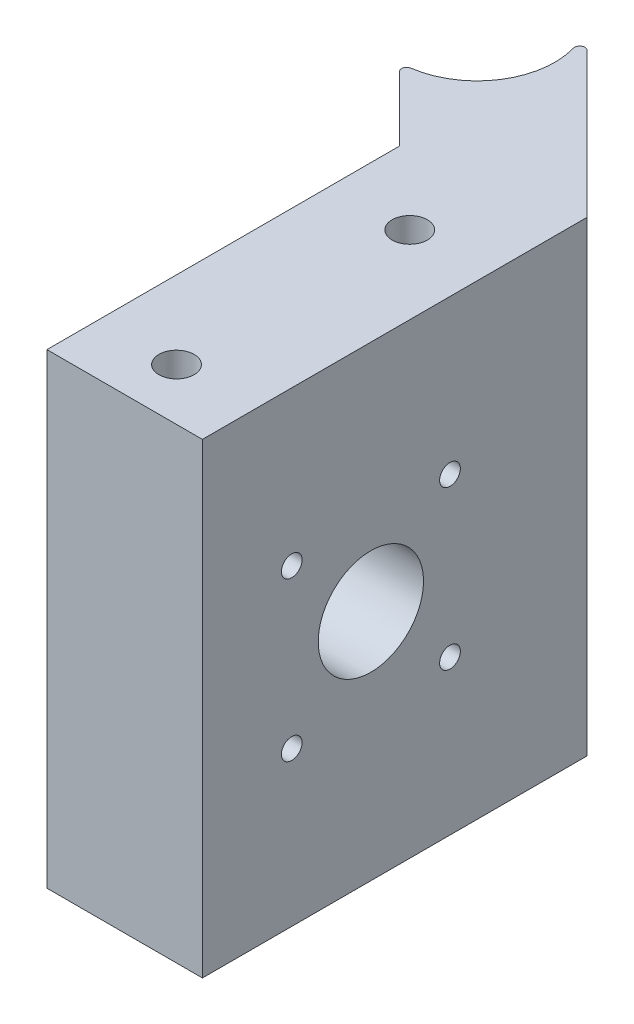
from build123d import *

# Parameters (mm, degrees)
SKETCH1_R           = 1.7
BOSS_EXTRUDE1_DEPTH = 45
CUT_EXTRUDE1_REACH  = 71.934
SKETCH2_R           = 5.0800000000000045
SKETCH2_R_2         = 1.0000000000000009
SKETCH2_R_3         = 1.0000000000000018
FILLET1_R           = 0.5
CUT_EXTRUDE2_DEPTH  = 2
CUT_EXTRUDE3_START  = 17
CUT_EXTRUDE3_DEPTH  = 2


with BuildPart() as part:
    # Sketch1 → Boss-Extrude1 (new body)
    with BuildSketch(Plane(origin=(0, 0, 0), x_dir=(1, 0, 0), z_dir=(0, 1, 0))):
        with BuildLine():
            Line((-7.499999999999999, -5.000000000000001), (7.500000000000001, -4.999999999999999))
            Line((7.500000000000001, -5), (7.499999999999998, 32.10660171779804))
            Line((7.499999999999998, 32.10660171779804), (-9.196699141100867, 48.80330085889908))
            ThreePointArc((-9.196699141100867, 48.80330085889908), (-7.57090350616536, 40.62987425726181), (-14.499999999999998, 36))
            Line((-14.499999999999998, 36), (-7.5, 28.999999999999925))
            Line((-7.5, 28.99999999999993), (-7.499999999999999, -5.000000000000001))
        make_face()
        Circle(SKETCH1_R, mode=Mode.SUBTRACT)
        with Locations((0, 22.5)):
            Circle(SKETCH1_R, mode=Mode.SUBTRACT)
    extrude(amount=BOSS_EXTRUDE1_DEPTH)

    # Sketch2 → Cut-Extrude1 (cut, up to next)
    with BuildSketch(Plane(origin=(7.500000000000001, 0, -5.3e-16), x_dir=(-1.2e-16, 0, -1), z_dir=(1, 0, -1.2e-16)), mode=Mode.PRIVATE) as cut_extrude1_sk1:
        with Locations((11.25, 22.5)):
            Circle(SKETCH2_R)
    cut_extrude1_tool1 = extrude(cut_extrude1_sk1.sketch, amount=-CUT_EXTRUDE1_REACH, mode=Mode.PRIVATE) & part.part
    # Sketch2 → Cut-Extrude1 (cut, up to next)
    with BuildSketch(Plane(origin=(7.500000000000001, 0, -5.3e-16), x_dir=(-1.2e-16, 0, -1), z_dir=(1, 0, -1.2e-16)), mode=Mode.PRIVATE) as cut_extrude1_sk2:
        with Locations((3.616999999999997, 30.133)):
            Circle(SKETCH2_R_2)
    cut_extrude1_tool2 = extrude(cut_extrude1_sk2.sketch, amount=-CUT_EXTRUDE1_REACH, mode=Mode.PRIVATE) & part.part
    # Sketch2 → Cut-Extrude1 (cut, up to next)
    with BuildSketch(Plane(origin=(7.500000000000001, 0, -5.3e-16), x_dir=(-1.2e-16, 0, -1), z_dir=(1, 0, -1.2e-16)), mode=Mode.PRIVATE) as cut_extrude1_sk3:
        with Locations((18.882999999999996, 30.133)):
            Circle(SKETCH2_R_3)
    cut_extrude1_tool3 = extrude(cut_extrude1_sk3.sketch, amount=-CUT_EXTRUDE1_REACH, mode=Mode.PRIVATE) & part.part
    # Sketch2 → Cut-Extrude1 (cut, up to next)
    with BuildSketch(Plane(origin=(7.500000000000001, 0, -5.3e-16), x_dir=(-1.2e-16, 0, -1), z_dir=(1, 0, -1.2e-16)), mode=Mode.PRIVATE) as cut_extrude1_sk4:
        with Locations((18.883, 14.867)):
            Circle(SKETCH2_R_3)
    cut_extrude1_tool4 = extrude(cut_extrude1_sk4.sketch, amount=-CUT_EXTRUDE1_REACH, mode=Mode.PRIVATE) & part.part
    # Sketch2 → Cut-Extrude1 (cut, up to next)
    with BuildSketch(Plane(origin=(7.500000000000001, 0, -5.3e-16), x_dir=(-1.2e-16, 0, -1), z_dir=(1, 0, -1.2e-16)), mode=Mode.PRIVATE) as cut_extrude1_sk5:
        with Locations((3.6169999999999987, 14.867)):
            Circle(SKETCH2_R_2)
    cut_extrude1_tool5 = extrude(cut_extrude1_sk5.sketch, amount=-CUT_EXTRUDE1_REACH, mode=Mode.PRIVATE) & part.part
    add(cut_extrude1_tool1.solids().sort_by_distance((7.5, 22.5, -11.25))[0], mode=Mode.SUBTRACT)
    add(cut_extrude1_tool2.solids().sort_by_distance((7.5, 30.133, -3.617))[0], mode=Mode.SUBTRACT)
    add(cut_extrude1_tool3.solids().sort_by_distance((7.5, 30.133, -18.883))[0], mode=Mode.SUBTRACT)
    add(cut_extrude1_tool4.solids().sort_by_distance((7.5, 14.867, -18.883))[0], mode=Mode.SUBTRACT)
    add(cut_extrude1_tool5.solids().sort_by_distance((7.5, 14.867, -3.617))[0], mode=Mode.SUBTRACT)

    # Fillet1
    fillet1_edges = [part.edges().sort_by_distance(p)[0] for p in [
        (-9.196699141100865, 22.5, -48.80330085889908),
        (-14.499999999999998, 22.5, -36),
    ]]
    fillet(fillet1_edges, radius=FILLET1_R)

    # Sketch3 → Cut-Extrude2 (cut, symmetric)
    with BuildSketch(Plane(origin=(0, 22.5, 0), x_dir=(1, 0, 0), z_dir=(0, 1, 0))):
        with BuildLine():
            Line((-8.136038969321103, 37.136038969321035), (-2.832738110421976, 42.43933982822012))
            Line((-2.832738110421976, 42.43933982822012), (-1.7720779386421608, 41.37867965644029))
            Line((-1.7720779386421608, 41.37867965644029), (-7.075378797541293, 36.07537879754122))
            ThreePointArc((-7.075378797541293, 36.07537879754122), (-9.276718417433418, 34.39135962345529), (-11.841997191011885, 33.34199719101184))
            Line((-11.841997191011885, 33.34199719101184), (-13.108259049699234, 34.60825904969921))
            ThreePointArc((-13.108259049699234, 34.60825904969921), (-10.421379383302021, 35.477229040721255), (-8.136038969321103, 37.136038969321035))
        make_face()
    extrude(amount=CUT_EXTRUDE2_DEPTH, both=True, mode=Mode.SUBTRACT)

    # Sketch3<2> → Cut-Extrude3 (cut, symmetric)
    with BuildSketch(Plane(origin=(0, 22.5, 0), x_dir=(1, 0, 0), z_dir=(0, 1, 0)).offset(CUT_EXTRUDE3_START)):
        with BuildLine():
            Line((-8.136038969321103, 37.136038969321035), (-2.832738110421976, 42.43933982822012))
            Line((-2.832738110421976, 42.43933982822012), (-1.7720779386421608, 41.37867965644029))
            Line((-1.7720779386421608, 41.37867965644029), (-7.075378797541293, 36.07537879754122))
            ThreePointArc((-7.075378797541293, 36.07537879754122), (-9.276718417433418, 34.39135962345529), (-11.841997191011885, 33.34199719101184))
            Line((-11.841997191011885, 33.34199719101184), (-13.108259049699234, 34.60825904969921))
            ThreePointArc((-13.108259049699234, 34.60825904969921), (-10.421379383302021, 35.477229040721255), (-8.136038969321103, 37.136038969321035))
        make_face()
    cut_extrude3 = extrude(amount=CUT_EXTRUDE3_DEPTH, both=True, mode=Mode.SUBTRACT)

    # Mirror1: Cut-Extrude3 across plane
    add(cut_extrude3.mirror(Plane.ZX.offset(22.5)), mode=Mode.SUBTRACT)


solid = part.part
